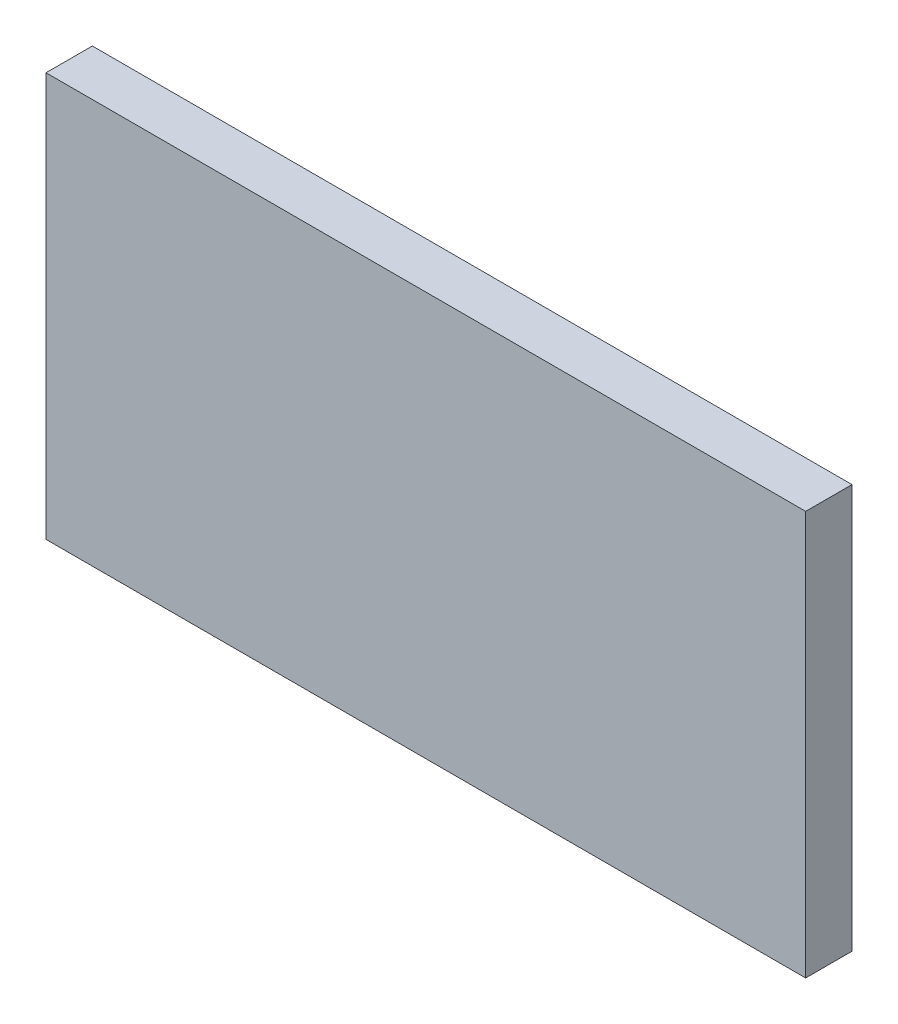
from build123d import *

# Parameters (mm, degrees)
ESQUISSE1_W        = 250
ESQUISSE1_H        = 133
BOSS_EXTRU_1_DEPTH = 15.25


with BuildPart() as part:
    # Esquisse1 → Boss.-Extru.1 (new body)
    with BuildSketch(Plane.XY):
        with Locations((0, 888.870969311)):
            Rectangle(ESQUISSE1_W, ESQUISSE1_H)
    extrude(amount=BOSS_EXTRU_1_DEPTH)


solid = part.part
